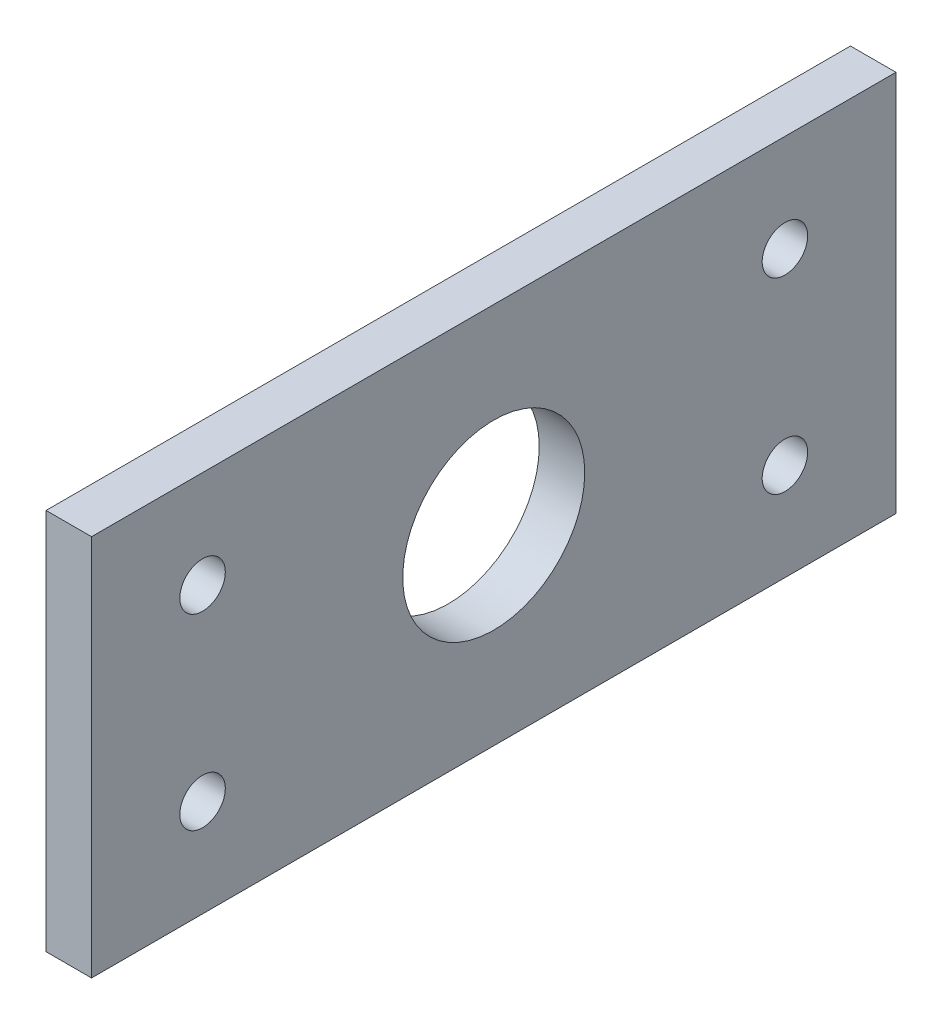
from build123d import *

# Parameters (mm, degrees)
SKETCH1_W           = 112.268
SKETCH1_H           = 53.34
SKETCH1_R           = 12.7
SKETCH1_R_2         = 3.175
BOSS_EXTRUDE1_DEPTH = 6.35


with BuildPart() as part:
    # Sketch1 → Boss-Extrude1 (new body)
    with BuildSketch(Plane(origin=(0, 0, 0), x_dir=(0, 0, -1), z_dir=(1, 0, 0))):
        Rectangle(SKETCH1_W, SKETCH1_H)
        Circle(SKETCH1_R, mode=Mode.SUBTRACT)
        with Locations((-40.64, -13.081)):
            Circle(SKETCH1_R_2, mode=Mode.SUBTRACT)
        with Locations((40.64, -13.081)):
            Circle(SKETCH1_R_2, mode=Mode.SUBTRACT)
        with Locations((-40.64, 13.081)):
            Circle(SKETCH1_R_2, mode=Mode.SUBTRACT)
        with Locations((40.64, 13.081)):
            Circle(SKETCH1_R_2, mode=Mode.SUBTRACT)
    extrude(amount=BOSS_EXTRUDE1_DEPTH)


solid = part.part
